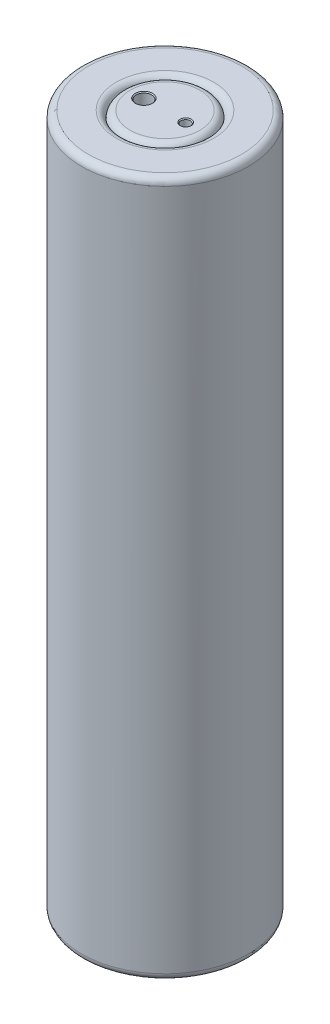
from build123d import *

# Parameters (mm, degrees)
CONG_1_R                                            = 5
CONG_2_R                                            = 5
ESQUISSE3_W                                         = 30
ESQUISSE3_H                                         = 500
ESQUISSE3_W_2                                       = 22
ESQUISSE3_H_2                                       = 480
CONG_3_R                                            = 5
CONG_4_R                                            = 5
PER_AGE_POUR_TUYAU_POUR_TROU_TARAUD_1_4_D           = 11.1252
PER_AGE_POUR_TUYAU_POUR_TROU_TARAUD_1_4_DEPTH       = 10
PER_AGE_POUR_TUYAU_POUR_TROU_TARAUD_1_4_CSINK_D     = 12.3952
PER_AGE_POUR_TUYAU_POUR_TROU_TARAUD_1_4_CSINK_ANGLE = 90
D_GAGEMENT_1_41_D                                   = 6.7564
D_GAGEMENT_1_41_DEPTH                               = 10
D_GAGEMENT_1_41_CSINK_D                             = 8.0264
D_GAGEMENT_1_41_CSINK_ANGLE                         = 90
D_GAGEMENT_1_21_D                                   = 13.49248
D_GAGEMENT_1_21_DEPTH                               = 10
D_GAGEMENT_1_21_CSINK_D                             = 14.76248
D_GAGEMENT_1_21_CSINK_ANGLE                         = 90


with BuildPart() as part:
    # Esquisse2 → Révolution1 (revolve)
    with BuildSketch(Plane(origin=(0, 0, 0), x_dir=(0, 0, -1), z_dir=(1, 0, 0))):
        Polygon((12.834024955, -467.667682927), (12.834024955, -477.667682927), (-17.165975045, -477.667682927), (-17.165975045, 22.332317073), (12.834024955, 22.332317073), (12.834024955, 12.332317073), (-13.165975045, 12.332317073), (-13.165975045, -467.667682927), align=None)
    revolve(axis=Axis((0, -467.667682927, -12.834024955), (0, -1, 0)))

    # Congé1
    cong_1_edges = [part.edges().sort_by_distance(p)[0] for p in [
        (0, 22.332317073, -42.834024955),
    ]]
    fillet(cong_1_edges, radius=CONG_1_R)

    # Congé2
    cong_2_edges = [part.edges().sort_by_distance(p)[0] for p in [
        (0, -477.667682927, -42.834024955),
    ]]
    fillet(cong_2_edges, radius=CONG_2_R)

    # Esquisse3 → Révolution2 (revolve)
    with BuildSketch(Plane(origin=(0, 0, 0), x_dir=(0, 0, -1), z_dir=(1, 0, 0)), mode=Mode.PRIVATE) as r_volution2_sk:
        with Locations((-32.165975045, -227.667682927)):
            Rectangle(ESQUISSE3_W, ESQUISSE3_H)
        with Locations((-32.165975045, -227.667682927)):
            Rectangle(ESQUISSE3_W_2, ESQUISSE3_H_2, mode=Mode.SUBTRACT)
    revolve(r_volution2_sk.sketch.rotate(Axis((0, -472.667682927, -12.834024955), (0, 1, 0)), 180), axis=Axis((0, -472.667682927, -12.834024955), (0, 1, 0)))

    # Congé3
    cong_3_edges = [part.edges().sort_by_distance(p)[0] for p in [
        (0, 22.332317073, 47.165975045),
        (0, 22.332317073, 17.165975045),
    ]]
    fillet(cong_3_edges, radius=CONG_3_R - 0.0001)  # a hair under: the kernel refuses the full size

    # Congé4
    cong_4_edges = [part.edges().sort_by_distance(p)[0] for p in [
        (0, -477.667682927, 17.165975045),
        (0, -477.667682927, 47.165975045),
    ]]
    fillet(cong_4_edges, radius=CONG_4_R - 0.0001)  # a hair under: the kernel refuses the full size

    # Perçage pour tuyau pour trou taraudé 1/41
    with Locations(Plane(origin=(-14.998951778, 22.332317073, -12.656696011), x_dir=(0, 0, 1), z_dir=(0, 1, 0))):
        with Locations((0, 0)):
            CounterSinkHole(PER_AGE_POUR_TUYAU_POUR_TROU_TARAUD_1_4_D / 2, PER_AGE_POUR_TUYAU_POUR_TROU_TARAUD_1_4_CSINK_D / 2, depth=PER_AGE_POUR_TUYAU_POUR_TROU_TARAUD_1_4_DEPTH, counter_sink_angle=PER_AGE_POUR_TUYAU_POUR_TROU_TARAUD_1_4_CSINK_ANGLE)

    # Dégagement 1/41
    with Locations(Plane(origin=(14.99906557, 22.332317073, -12.666597303), x_dir=(0, 0, 1), z_dir=(0, 1, 0))):
        with Locations((0, 0)):
            CounterSinkHole(D_GAGEMENT_1_41_D / 2, D_GAGEMENT_1_41_CSINK_D / 2, depth=D_GAGEMENT_1_41_DEPTH, counter_sink_angle=D_GAGEMENT_1_41_CSINK_ANGLE)

    # Dégagement 1/21
    with Locations(Plane(origin=(-44.999519302, -477.667682927, -13.042021564), x_dir=(0, 0, -1), z_dir=(0, -1, 0))):
        with Locations((0, 0)):
            CounterSinkHole(D_GAGEMENT_1_21_D / 2, D_GAGEMENT_1_21_CSINK_D / 2, depth=D_GAGEMENT_1_21_DEPTH, counter_sink_angle=D_GAGEMENT_1_21_CSINK_ANGLE)


solid = part.part
